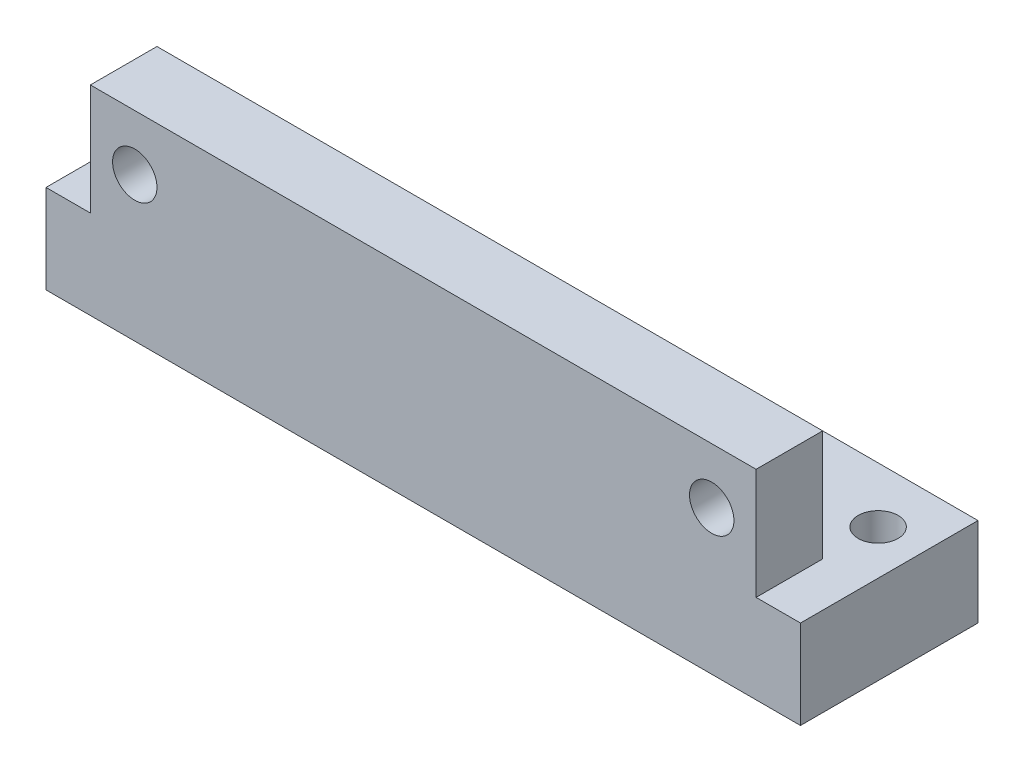
from build123d import *

# Parameters (mm, degrees)
SKETCH2_W           = 43.18
SKETCH2_H           = 10.16
BOSS_EXTRUDE1_DEPTH = 5.08
SKETCH3_W           = 38.1
SKETCH3_H           = 3.81
BOSS_EXTRUDE2_DEPTH = 6.35
SKETCH4_R           = 1.143
CUT_EXTRUDE1_DEPTH  = 24.070695698
SKETCH5_R           = 1.27
CUT_EXTRUDE2_DEPTH  = 27.457486653


with BuildPart() as part:
    # Sketch2 → Boss-Extrude1 (new body)
    with BuildSketch(Plane(origin=(0, 0, 0), x_dir=(1, 0, 0), z_dir=(0, 1, 0))):
        Rectangle(SKETCH2_W, SKETCH2_H)
    extrude(amount=BOSS_EXTRUDE1_DEPTH)

    # Sketch3 → Boss-Extrude2 (add)
    with BuildSketch(Plane(origin=(0, 5.08, 0), x_dir=(1, 0, 0), z_dir=(0, 1, 0))):
        with Locations((0, -3.175)):
            Rectangle(SKETCH3_W, SKETCH3_H)
    extrude(amount=BOSS_EXTRUDE2_DEPTH)

    # Sketch4 → Cut-Extrude1 (cut, through all)
    with BuildSketch(Plane(origin=(0, 5.08, 0), x_dir=(1, 0, 0), z_dir=(0, 1, 0))):
        with Locations((19.05, 1.905)):
            Circle(SKETCH4_R)
        with Locations((-19.05, 1.905)):
            Circle(SKETCH4_R)
    extrude(amount=-CUT_EXTRUDE1_DEPTH, mode=Mode.SUBTRACT)

    # Sketch5 → Cut-Extrude2 (cut, through all)
    with BuildSketch(Plane.XY.offset(5.08)):
        with Locations((-16.51, 8.255)):
            Circle(SKETCH5_R)
        with Locations((16.51, 8.255)):
            Circle(SKETCH5_R)
    extrude(amount=-CUT_EXTRUDE2_DEPTH, mode=Mode.SUBTRACT)


solid = part.part
